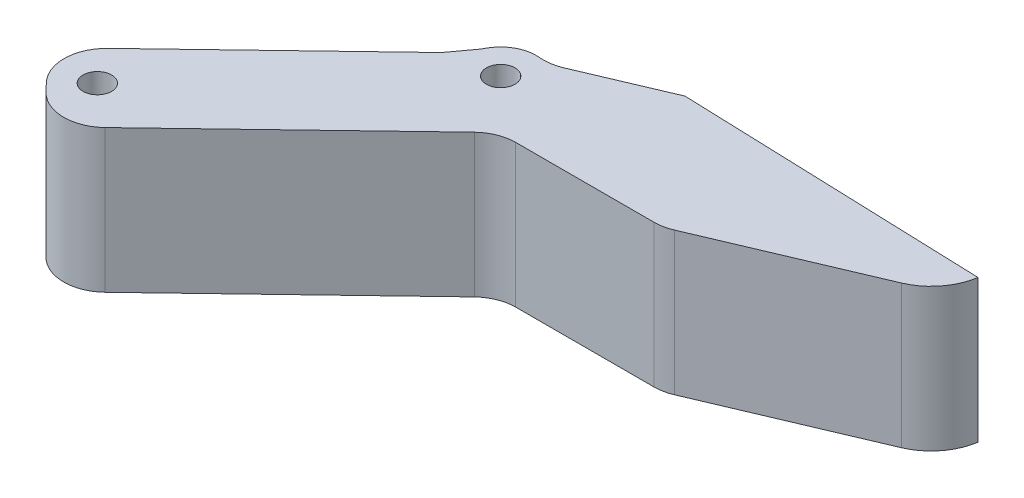
from build123d import *
from OCP.BRepFilletAPI import BRepFilletAPI_MakeChamfer

# Parameters (mm, degrees)
SKETCH1_W           = 82.55
SKETCH1_H           = 25.4
SKETCH1_R           = 2.54
BOSS_EXTRUDE1_DEPTH = 25.4
CHAMFER1_SIZE       = 15.24
CHAMFER1_SIZE2      = 35.903190055
FILLET1_R           = 10
CHAMFER2_SIZE       = 5.08
CHAMFER2_SIZE_2     = 145.472166677
BOSS_EXTRUDE2_DEPTH = 25.4
SKETCH3_R           = 2.54
CUT_EXTRUDE1_DEPTH  = 92.63619095
SKETCH4_R           = 2.54
CUT_EXTRUDE2_DEPTH  = 92.63619095
FILLET3_R           = 7.62
FILLET4_R           = 7.62
SKETCH5_R           = 6.35
SKETCH5_R_2         = 2.54
BOSS_EXTRUDE3_DEPTH = 25.4
FILLET5_R           = 7.62
CUT_EXTRUDE3_DEPTH  = 91.009898604
FILLET6_R           = 7.62


with BuildPart() as part:
    # Sketch1 → Boss-Extrude1 (new body)
    with BuildSketch(Plane(origin=(0, 0, 0), x_dir=(1, 0, 0), z_dir=(0, 1, 0))):
        with Locations((32.385, 3.81)):
            Rectangle(SKETCH1_W, SKETCH1_H)
        with Locations(Location((0, 0, 0), (0, 0, 270))):
            Circle(SKETCH1_R, mode=Mode.SUBTRACT)
    extrude(amount=BOSS_EXTRUDE1_DEPTH)

    # Chamfer1: one chamfer whose edges measure the first distance from different faces: ONE call of the kernel's chamfer builder (chamfer() names one face for all edges)
    chamfer1_edges_1 = [part.edges().sort_by_distance(p)[0] for p in [
        (-8.89, 12.7, -16.51),
    ]]
    chamfer1_side_1 = [part.faces().sort_by_distance(p)[0] for p in [
        (-8.89, 12.7, -3.81),
    ]]
    chamfer1_edges_2 = [part.edges().sort_by_distance(p)[0] for p in [
        (73.66, 12.7, 8.89),
    ]]
    chamfer1_side_2 = [part.faces().sort_by_distance(p)[0] for p in [
        (73.66, 12.7, -3.81),
    ]]
    chamfer1 = BRepFilletAPI_MakeChamfer(part.part.solid().wrapped)
    for e in chamfer1_edges_1:
        chamfer1.Add(CHAMFER1_SIZE, CHAMFER1_SIZE2, e.wrapped, chamfer1_side_1[0].wrapped)  # the first distance lies on this face
    for e in chamfer1_edges_2:
        chamfer1.Add(CHAMFER1_SIZE, CHAMFER1_SIZE2, e.wrapped, chamfer1_side_2[0].wrapped)  # the first distance lies on this face
    add(Compound.cast(chamfer1.Shape()), mode=Mode.REPLACE)

    # Fillet1
    fillet1_edges = [part.edges().sort_by_distance(p)[0] for p in [
        (73.66, 12.7, -6.35),
    ]]
    fillet(fillet1_edges, radius=FILLET1_R)

    # Chamfer2
    # the kernel refuses this chamfer: 145.472166677, 5.08 mm, written as the material it takes off along each edge
    with BuildSketch(Plane(origin=(73.66, -378.219112331, -16.51), x_dir=(0.7401679873250444, 0, 0.6724220033127953), z_dir=(0, 1, 0))) as chamfer2_piece_1:
        Polygon((CHAMFER2_SIZE * 0.672422003313, -CHAMFER2_SIZE * 0.740167987325), (-CHAMFER2_SIZE_2 * 0.740167987326, -CHAMFER2_SIZE_2 * 0.672422003314), (0, 0), align=None)
    extrude(amount=781.838224662, mode=Mode.SUBTRACT)

    # Sketch2 → Boss-Extrude2 (add)
    with BuildSketch(Plane(origin=(0, 25.4, 0), x_dir=(1, 0, 0), z_dir=(0, 1, 0))):
        Polygon((-3.433319289, 3.586223542), (-44.714941303, -35.935291914), (-32.770661076, -48.411515456), (8.510960938, -8.89), align=None)
    extrude(amount=-BOSS_EXTRUDE2_DEPTH)

    # Sketch3 → Cut-Extrude1 (cut, through all)
    with BuildSketch(Plane(origin=(0, 25.4, 0), x_dir=(1, 0, 0), z_dir=(0, 1, 0))):
        with Locations(Location((0, 0, 0), (0, 0, 270))):
            Circle(SKETCH3_R)
    extrude(amount=-CUT_EXTRUDE1_DEPTH, mode=Mode.SUBTRACT)

    # Sketch4 → Cut-Extrude2 (cut, through all)
    with BuildSketch(Plane(origin=(0, 25.4, 0), x_dir=(1, 0, 0), z_dir=(0, 1, 0))):
        with Locations(Location((-34.808399123, -37.000207438, 0), (0, 0, 270))):
            Circle(SKETCH4_R)
    extrude(amount=-CUT_EXTRUDE2_DEPTH, mode=Mode.SUBTRACT)

    # Fillet3
    fillet3_edges = [part.edges().sort_by_distance(p)[0] for p in [
        (-44.714941303, 12.7, 35.935291914),
        (-32.770661076, 12.7, 48.411515456),
    ]]
    fillet(fillet3_edges, radius=FILLET3_R)

    # Fillet4
    fillet4_edges = [part.edges().sort_by_distance(p)[0] for p in [
        (37.756809945, 12.7, 8.89),
        (8.510960938, 12.7, 8.89),
    ]]
    fillet(fillet4_edges, radius=FILLET4_R)

    # Sketch5 → Boss-Extrude3 (add)
    with BuildSketch(Plane(origin=(0, 25.4, 0), x_dir=(1, 0, 0), z_dir=(0, 1, 0))):
        Circle(SKETCH5_R)
        with Locations(Location((0, 0, 0), (0, 0, 270))):
            Circle(SKETCH5_R_2, mode=Mode.SUBTRACT)
    extrude(amount=-BOSS_EXTRUDE3_DEPTH)

    # Fillet5
    fillet5_edges = [part.edges().sort_by_distance(p)[0] for p in [
        (2.173832351, 12.7, -5.966318204),
    ]]
    fillet(fillet5_edges, radius=FILLET5_R)

    # Sketch6 → Cut-Extrude3 (cut, through all)
    with BuildSketch(Plane(origin=(0, 25.4, 0), x_dir=(1, 0, 0), z_dir=(0, 1, 0))):
        Polygon((-5.801880984, 2.580828752), (-8.89, -1.637803048), (-8.89, 1.27), align=None)
    extrude(amount=-CUT_EXTRUDE3_DEPTH, mode=Mode.SUBTRACT)

    # Fillet6
    fillet6_edges = [part.edges().sort_by_distance(p)[0] for p in [
        (-5.801880984, 12.7, -2.580828752),
        (-8.89, 12.7, 1.637803048),
    ]]
    fillet(fillet6_edges, radius=FILLET6_R)


solid = part.part
